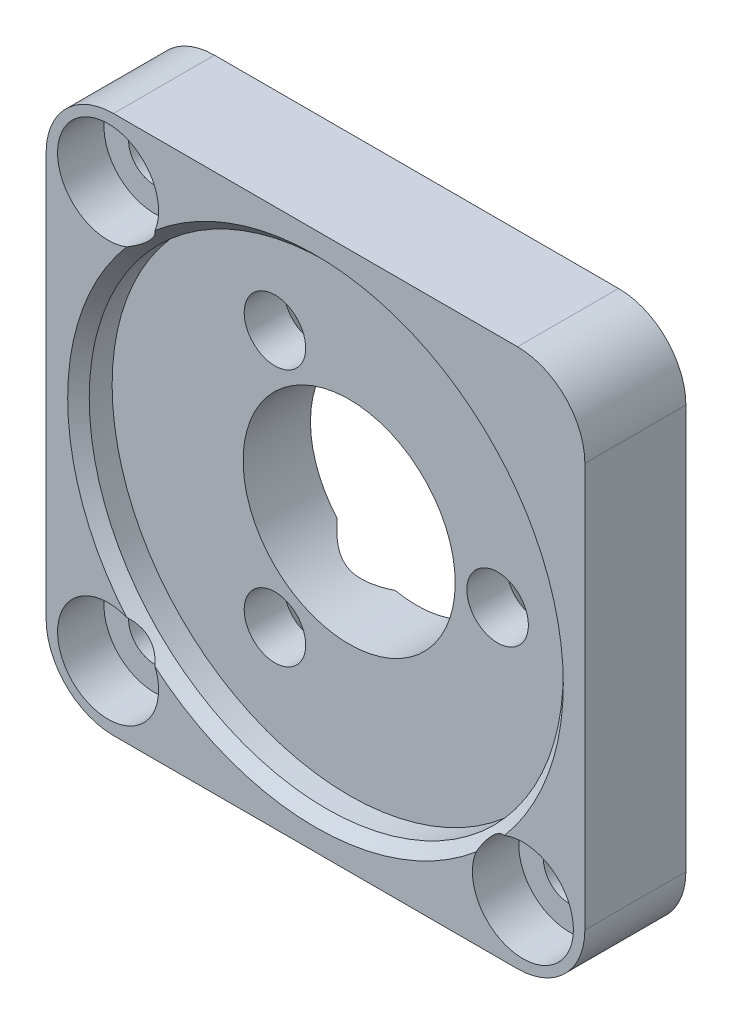
from build123d import *

# Parameters (mm, degrees)
BOSS_EXTRUDE2_DEPTH                               = 4.7625
SKETCH9_R                                         = 5
CUT_EXTRUDE1_DEPTH                                = 19.581211108
CSK_FOR_M2_5_FLAT_HEAD_MACHINE_SCREW1_D           = 2.9
CSK_FOR_M2_5_FLAT_HEAD_MACHINE_SCREW1_CSINK_D     = 5.5
CSK_FOR_M2_5_FLAT_HEAD_MACHINE_SCREW1_CSINK_ANGLE = 90
CBORE_FOR_2_SOCKET_HEAD_CAP_SCREW1_D              = 2.4384
CBORE_FOR_2_SOCKET_HEAD_CAP_SCREW1_CBORE_D        = 4.7625
CBORE_FOR_2_SOCKET_HEAD_CAP_SCREW1_CBORE_DEPTH    = 2.1844
FILLET1_R                                         = 3.175
CIRPATTERN1_COUNT                                 = 3
SKETCH10_R                                        = 11.176
CUT_EXTRUDE2_DEPTH                                = 1.5875
CHAMFER1_SIZE                                     = 0.508


with BuildPart() as part:
    # Sketch1 → Boss-Extrude2 (new body)
    with BuildSketch(Plane.XY):
        Polygon((12.7, 12.7), (-12.7, 12.7), (0, 0), align=None)
        Polygon((-12.7, 12.7), (-12.7, -12.7), (0, 0), align=None)
        Polygon((0, 0), (-12.7, -12.7), (12.7, -12.7), align=None)
        Polygon((0, 0), (12.7, -12.7), (12.7, 12.7), align=None)
    extrude(amount=BOSS_EXTRUDE2_DEPTH)

    # Sketch9 → Cut-Extrude1 (cut, through all)
    with BuildSketch(Plane.XY.offset(4.7625)):
        Circle(SKETCH9_R)
    extrude(amount=-CUT_EXTRUDE1_DEPTH, mode=Mode.SUBTRACT)

    # CSK for M2.5 Flat Head Machine Screw1 (through all)
    with Locations(Plane(origin=(0, 0, 0), x_dir=(-1, 0, 0), z_dir=(0, 0, -1))):
        with Locations((3.5, 6.062177826)):
            csk_for_m2_5_flat_head_machine_screw1 = CounterSinkHole(CSK_FOR_M2_5_FLAT_HEAD_MACHINE_SCREW1_D / 2, CSK_FOR_M2_5_FLAT_HEAD_MACHINE_SCREW1_CSINK_D / 2, counter_sink_angle=CSK_FOR_M2_5_FLAT_HEAD_MACHINE_SCREW1_CSINK_ANGLE)

    # CBORE for #2 Socket Head Cap Screw1 (through all)
    with Locations(Plane.XY.offset(4.7625)):
        with Locations((0, 0), (-9.779, -9.779), (9.779, -9.779), (-9.779, 9.779)):
            CounterBoreHole(CBORE_FOR_2_SOCKET_HEAD_CAP_SCREW1_D / 2, CBORE_FOR_2_SOCKET_HEAD_CAP_SCREW1_CBORE_D / 2, CBORE_FOR_2_SOCKET_HEAD_CAP_SCREW1_CBORE_DEPTH)

    # Fillet1
    fillet1_edges = [part.edges().sort_by_distance(p)[0] for p in [
        (12.7, 12.7, 2.38125),
        (12.7, -12.7, 2.38125),
        (-12.7, -12.7, 2.38125),
        (-12.7, 12.7, 2.38125),
    ]]
    fillet(fillet1_edges, radius=FILLET1_R)

    # CirPattern1: CSK for M2.5 Flat Head Machine Screw1 ×3 about axis
    cirpattern1_axis = Axis((0, 0, 0), (0, 0, 1))
    for i in range(1, CIRPATTERN1_COUNT):
        add(csk_for_m2_5_flat_head_machine_screw1.rotate(cirpattern1_axis, i * 360 / CIRPATTERN1_COUNT), mode=Mode.SUBTRACT)

    # Sketch10 → Cut-Extrude2 (cut)
    with BuildSketch(Plane.XY.offset(4.7625)):
        Circle(SKETCH10_R)
    extrude(amount=-CUT_EXTRUDE2_DEPTH, mode=Mode.SUBTRACT)

    # Chamfer1
    # the kernel refuses this chamfer: 0.508 mm, written as the material it takes off along each edge
    with BuildSketch(Plane(origin=(0, 0, 4.7625), x_dir=(1, 0, 0), z_dir=(0, -1, 0))) as chamfer1_piece_1:
        Polygon((11.176 + CHAMFER1_SIZE, 0), (11.176, -CHAMFER1_SIZE), (11.176, 0), align=None)
    revolve(axis=Axis((0, 0, 4.7625), (0, 0, 1)), mode=Mode.SUBTRACT)


solid = part.part
